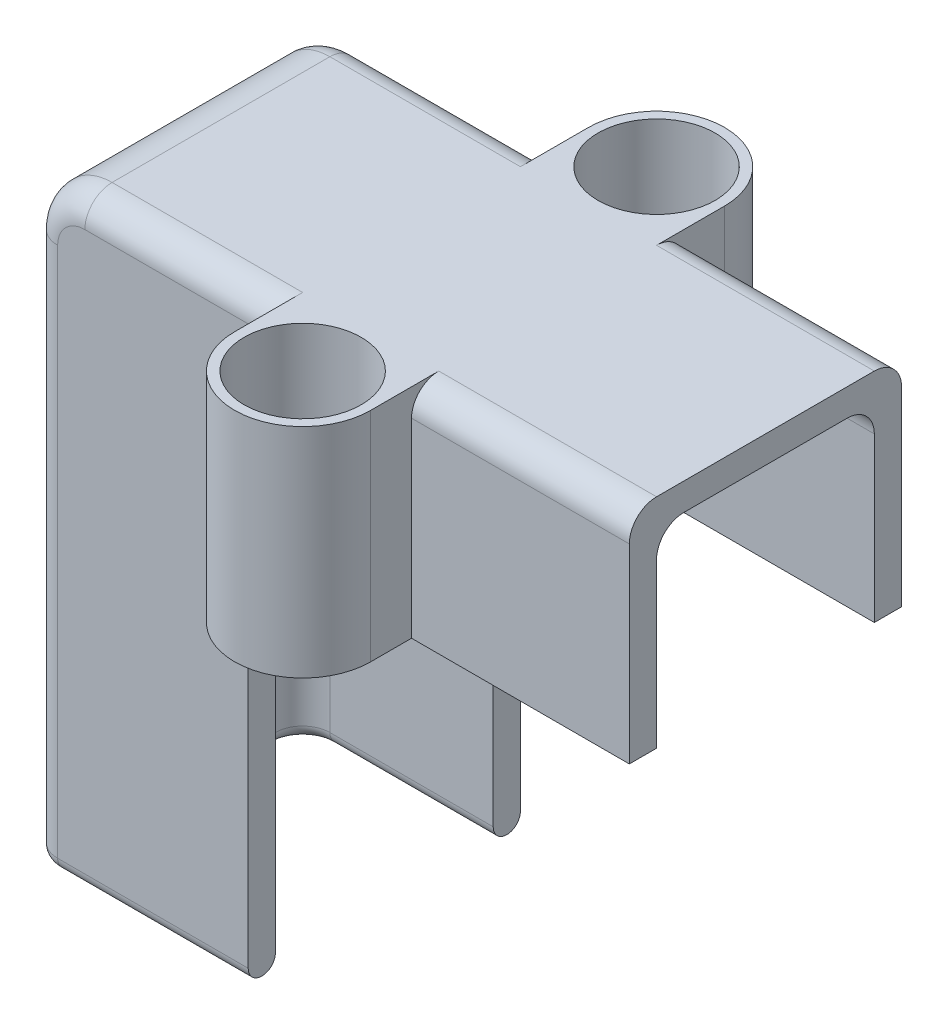
from build123d import *

# Parameters (mm, degrees)
EXTRUDE_1_DEPTH           = 5
EXTRUDE_1_2_DEPTH         = 8
CUT_EXTRUDE_1_DEPTH       = 4
FILLET_1_R                = 2
HOLE_WIZARD_1_D           = 2.4
HOLE_WIZARD_1_DEPTH       = 15
HOLE_WIZARD_1_CBORE_D     = 4.3
HOLE_WIZARD_1_CBORE_DEPTH = 5
HOLE_WIZARD_1_TIP         = 0.721032743
FILLET_2_R                = 1
FILLET_3_R                = 1
FILLET_4_R                = 1
FILLET_5_R                = 0.5
FILLET_6_R                = 0.5


with BuildPart() as part:
    # 草图1 → Extrude 1 (new, symmetric)
    with BuildSketch(Plane.XY):
        Polygon((4, -18), (4, -4), (18, -4), (18, 4), (-4, 4), (-4, -18), align=None)
    extrude(amount=EXTRUDE_1_DEPTH, both=True)

    # 草图3 → Extrude 1 2 (add)
    with BuildSketch(Plane(origin=(0, 4, 0), x_dir=(1, 0, 0), z_dir=(0, 1, 0))):
        with BuildLine():
            Line((10, 6.5), (10, -6.5))
            ThreePointArc((10, -6.5), (7.5, -9), (5, -6.5))
            Line((5, -6.5), (5, 6.5))
            ThreePointArc((5, 6.5), (7.5, 9), (10, 6.5))
        make_face()
    extrude(amount=-EXTRUDE_1_2_DEPTH)

    # 草图2 → 切除-拉伸1 (cut, symmetric)
    with BuildSketch(Plane.XY):
        Polygon((18, 3), (-3, 3), (-3, -18), (4, -18), (4, -4), (18, -4), align=None)
    extrude(amount=CUT_EXTRUDE_1_DEPTH, both=True, mode=Mode.SUBTRACT)

    # 圆角1
    fillet_1_edges = [part.edges().sort_by_distance(p)[0] for p in [
        (-3, 3, 0),
        (-4, 4, 0),
    ]]
    fillet(fillet_1_edges, radius=FILLET_1_R)

    # 打孔尺寸(%根据)内六角圆柱头螺钉的类型1
    with Locations(Plane(origin=(0, 4, 0), x_dir=(1, 0, 0), z_dir=(0, 1, 0))):
        with Locations((7.5, 6.5), (7.5, -6.5)):
            CounterBoreHole(HOLE_WIZARD_1_D / 2, HOLE_WIZARD_1_CBORE_D / 2, HOLE_WIZARD_1_CBORE_DEPTH, depth=HOLE_WIZARD_1_DEPTH)
            with Locations((0, 0, -(HOLE_WIZARD_1_DEPTH + HOLE_WIZARD_1_TIP / 2))):  # 118° drill point
                Cone(0, HOLE_WIZARD_1_D / 2, HOLE_WIZARD_1_TIP, mode=Mode.SUBTRACT)

    # 圆角2
    fillet_2_edges = [part.edges().sort_by_distance(p)[0] for p in [
        (1.5, 4, -5),
        (1.5, 4, 5),
        (8.5, 3, -4),
        (8.5, 3, 4),
        (-4, -8, -5),
        (-4, -8, 5),
        (-3.414213562, 3.414213562, -5),
        (-3.414213562, 3.414213562, 5),
        (-3, -8.5, 4),
        (-3, -8.5, -4),
        (-2.414213562, 2.414213562, 4),
        (-2.414213562, 2.414213562, -4),
    ]]
    fillet(fillet_2_edges, radius=FILLET_2_R)

    # 圆角3
    fillet_3_edges = [part.edges().sort_by_distance(p)[0] for p in [
        (14, 4, 5),
        (14, 4, -5),
    ]]
    fillet(fillet_3_edges, radius=FILLET_3_R)

    # 圆角4
    fillet_4_edges = [part.edges().sort_by_distance(p)[0] for p in [
        (4, -4, -4.5),
        (4, -4, 4.5),
    ]]
    fillet(fillet_4_edges, radius=FILLET_4_R)

    # 圆角5
    fillet_5_edges = [part.edges().sort_by_distance(p)[0] for p in [
        (-4, -18, 0),
        (-3.707106781, -18, -4.707106781),
        (-3.707106781, -18, 4.707106781),
        (0.5, -18, -5),
        (0.5, -18, 5),
    ]]
    fillet(fillet_5_edges, radius=FILLET_5_R)

    # 圆角6
    fillet_6_edges = [part.edges().sort_by_distance(p)[0] for p in [
        (1, -18, -4),
        (-2.707106781, -18, -3.707106781),
        (1, -18, 4),
        (-2.707106781, -18, 3.707106781),
        (-3, -18, 0),
    ]]
    fillet(fillet_6_edges, radius=FILLET_6_R - 0.0001)  # a hair under: the kernel refuses the full size


solid = part.part
